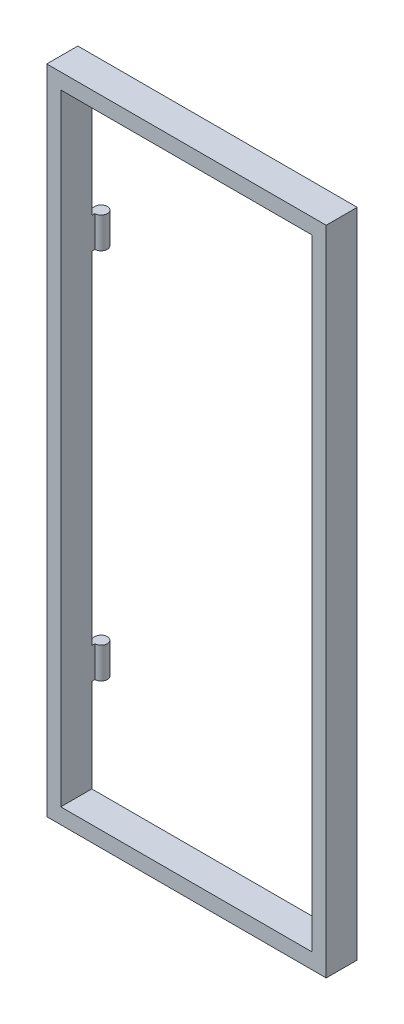
from build123d import *

# Parameters (mm, degrees)
SKETCH_1_W               = 900
SKETCH_1_H               = 2100
SKETCH_1_W_2             = 810
SKETCH_1_H_2             = 2000
EXTRUDE_1_DEPTH          = 100
SKETCH_2_W               = 20
SKETCH_2_H               = 100
EXTRUDE_2_DEPTH          = 30
SKETCH_3_R               = 20
EXTRUDE_3_DEPTH          = 100
PATTERN_LINEAR_1_COUNT   = 2
PATTERN_LINEAR_1_PITCH   = 1200
MIRROR_1_COPY_1_SKETCH_W = 20
MIRROR_1_COPY_1_SKETCH_H = 100
MIRROR_1_COPY_1_DEPTH    = 30
MIRROR_1_COPY_2_SKETCH_R = 20
MIRROR_1_COPY_2_DEPTH    = 100
DELETE_FACE_1_OUTLINE_W  = 41
DELETE_FACE_1_OUTLINE_H  = 100
DELETE_FACE_1_DEPTH      = 50


# Read off the part's stored shape, not the designer's step: Удалить грань1
with BuildPart() as part:
    # Эскиз1 → Бобышка-Вытянуть1 (new body)
    with BuildSketch(Plane.XY):
        with Locations((450, 1050)):
            Rectangle(SKETCH_1_W, SKETCH_1_H)
        with Locations((450, 1050)):
            Rectangle(SKETCH_1_W_2, SKETCH_1_H_2, mode=Mode.SUBTRACT)
    extrude(amount=-EXTRUDE_1_DEPTH)

    # Эскиз2 → Бобышка-Вытянуть2 (add)
    with BuildSketch(Plane.XY):
        with Locations((865, 1600)):
            Rectangle(SKETCH_2_W, SKETCH_2_H)
    extrude_2 = extrude(amount=EXTRUDE_2_DEPTH)

    # Эскиз3 → Бобышка-Вытянуть3 (add)
    with BuildSketch(Plane(origin=(0, 1650, 0), x_dir=(1, 0, 0), z_dir=(0, 1, 0))):
        with Locations((855, -30)):
            Circle(SKETCH_3_R)
    extrude_3 = extrude(amount=-EXTRUDE_3_DEPTH)

    # Линейный массив1: Бобышка-Вытянуть2, Бобышка-Вытянуть3 ×2
    with Locations(*[(0, -i * PATTERN_LINEAR_1_PITCH, 0) for i in range(1, PATTERN_LINEAR_1_COUNT)]):
        add(extrude_2)
        add(extrude_3)

    # Зеркальное отражение1: Бобышка-Вытянуть2, Бобышка-Вытянуть3 across plane
    add(extrude_2.mirror(Plane.XY.offset(-50)))
    add(extrude_3.mirror(Plane.XY.offset(-50)))

    # Зеркальное отражение1 copy 1 sketch → Зеркальное отражение1 copy 1 (add)
    with BuildSketch(Plane(origin=(0, -1200, -100), x_dir=(1, 0, 0), z_dir=(0, 0, -1))):
        with Locations((865, -1600)):
            Rectangle(MIRROR_1_COPY_1_SKETCH_W, MIRROR_1_COPY_1_SKETCH_H)
    extrude(amount=MIRROR_1_COPY_1_DEPTH)

    # Зеркальное отражение1 copy 2 sketch → Зеркальное отражение1 copy 2 (add)
    with BuildSketch(Plane(origin=(0, 450, -100), x_dir=(1, 0, 0), z_dir=(0, 1, 0))):
        with Locations((855, 30)):
            Circle(MIRROR_1_COPY_2_SKETCH_R)
    extrude(amount=-MIRROR_1_COPY_2_DEPTH)

    # Delete Face 1 outline → Delete Face 1 (cut)
    with BuildSketch(Plane.XY):
        with Locations((854.5, 1600)):
            Rectangle(DELETE_FACE_1_OUTLINE_W, DELETE_FACE_1_OUTLINE_H)
        with Locations((854.5, 400)):
            Rectangle(DELETE_FACE_1_OUTLINE_W, DELETE_FACE_1_OUTLINE_H)
    extrude(amount=DELETE_FACE_1_DEPTH, mode=Mode.SUBTRACT)


with BuildPart() as body_2:
    # Зеркальное отражение2: mirrored copy
    add(part.part.mirror(Plane(origin=(0, 0, 0), x_dir=(0, 0, 1), z_dir=(1, 0, 0))))


solid = body_2.part
